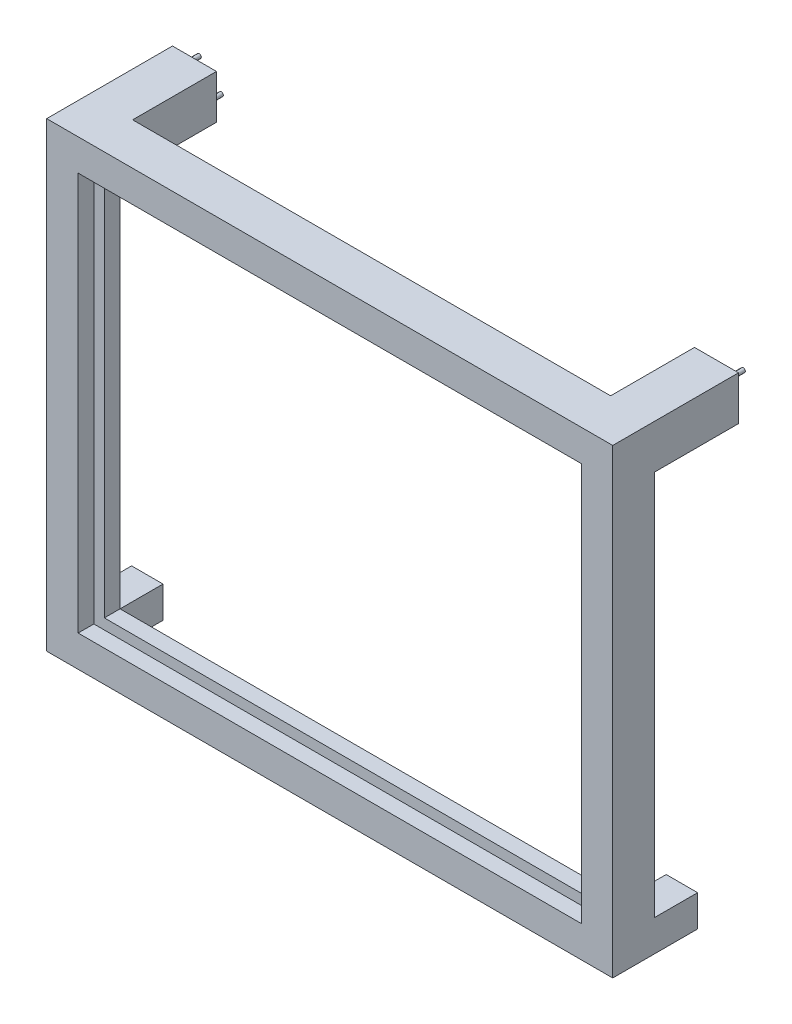
from build123d import *

# Parameters (mm, degrees)
ESQUISSE1_W                  = 540
ESQUISSE1_H                  = 440
ESQUISSE1_W_2                = 480
ESQUISSE1_H_2                = 380
BOSS_EXTRU_1_DEPTH           = 40
ENL_V_MAT_EXTRU_1_DEPTH      = 390
ENL_V_MAT_EXTRU_1_DEPTH_BACK = 10
ESQUISSE2_W                  = 500
ESQUISSE2_H                  = 10
ESQUISSE3_W                  = 42
ESQUISSE3_H                  = 42
BOSS_EXTRU_2_DEPTH           = 80
ESQUISSE5_R                  = 2
BOSS_EXTRU_3_DEPTH           = 15
ESQUISSE7_R                  = 4
ENL_V_MAT_EXTRU_2_DEPTH      = 20
ESQUISSE8_W                  = 30
ESQUISSE8_H                  = 30
BOSS_EXTRU_4_DEPTH           = 41


with BuildPart() as part:
    # Esquisse1 → Boss.-Extru.1 (new body)
    with BuildSketch(Plane.XY):
        Rectangle(ESQUISSE1_W, ESQUISSE1_H)
        Rectangle(ESQUISSE1_W_2, ESQUISSE1_H_2, mode=Mode.SUBTRACT)
    extrude(amount=BOSS_EXTRU_1_DEPTH)

    # Esquisse2 → Enlèv. mat.-Extru.1 (cut, two sides: drawn at the far end of the back side and taken through both)
    with BuildSketch(Plane(origin=(0, -190, 0), x_dir=(1, 0, 0), z_dir=(0, 1, 0)).offset(-ENL_V_MAT_EXTRU_1_DEPTH_BACK)):
        with Locations((0, -20)):
            Rectangle(ESQUISSE2_W, ESQUISSE2_H)
    extrude(amount=ENL_V_MAT_EXTRU_1_DEPTH + ENL_V_MAT_EXTRU_1_DEPTH_BACK, mode=Mode.SUBTRACT)

    # Esquisse3 → Boss.-Extru.2 (add)
    with BuildSketch(Plane(origin=(0, 0, 0), x_dir=(-1, 0, 0), z_dir=(0, 0, -1))):
        with Locations((-249, 199)):
            Rectangle(ESQUISSE3_W, ESQUISSE3_H)
        with Locations((249, 199)):
            Rectangle(ESQUISSE3_W, ESQUISSE3_H)
    extrude(amount=BOSS_EXTRU_2_DEPTH)

    # Esquisse5 → Boss.-Extru.3 (add)
    with BuildSketch(Plane(origin=(0, 0, -80), x_dir=(-1, 0, 0), z_dir=(0, 0, -1))):
        with Locations((-259.5, 209.5)):
            Circle(ESQUISSE5_R)
        with Locations((-238.5, 188.5)):
            Circle(ESQUISSE5_R)
        with Locations((259.5, 209.5)):
            Circle(ESQUISSE5_R)
        with Locations((238.5, 188.5)):
            Circle(ESQUISSE5_R)
    extrude(amount=BOSS_EXTRU_3_DEPTH)

    # Esquisse7 → Enlèv. mat.-Extru.2 (cut)
    with BuildSketch(Plane.XZ.offset(-178)):
        with Locations((249, -60.5)):
            Circle(ESQUISSE7_R)
        with Locations((-249, -60.5)):
            Circle(ESQUISSE7_R)
    extrude(amount=-ENL_V_MAT_EXTRU_2_DEPTH, mode=Mode.SUBTRACT)

    # Esquisse8 → Boss.-Extru.4 (add)
    with BuildSketch(Plane(origin=(0, 0, 0), x_dir=(-1, 0, 0), z_dir=(0, 0, -1))):
        with Locations((-255, -205)):
            Rectangle(ESQUISSE8_W, ESQUISSE8_H)
        with Locations((255, -205)):
            Rectangle(ESQUISSE8_W, ESQUISSE8_H)
    extrude(amount=BOSS_EXTRU_4_DEPTH)


solid = part.part
